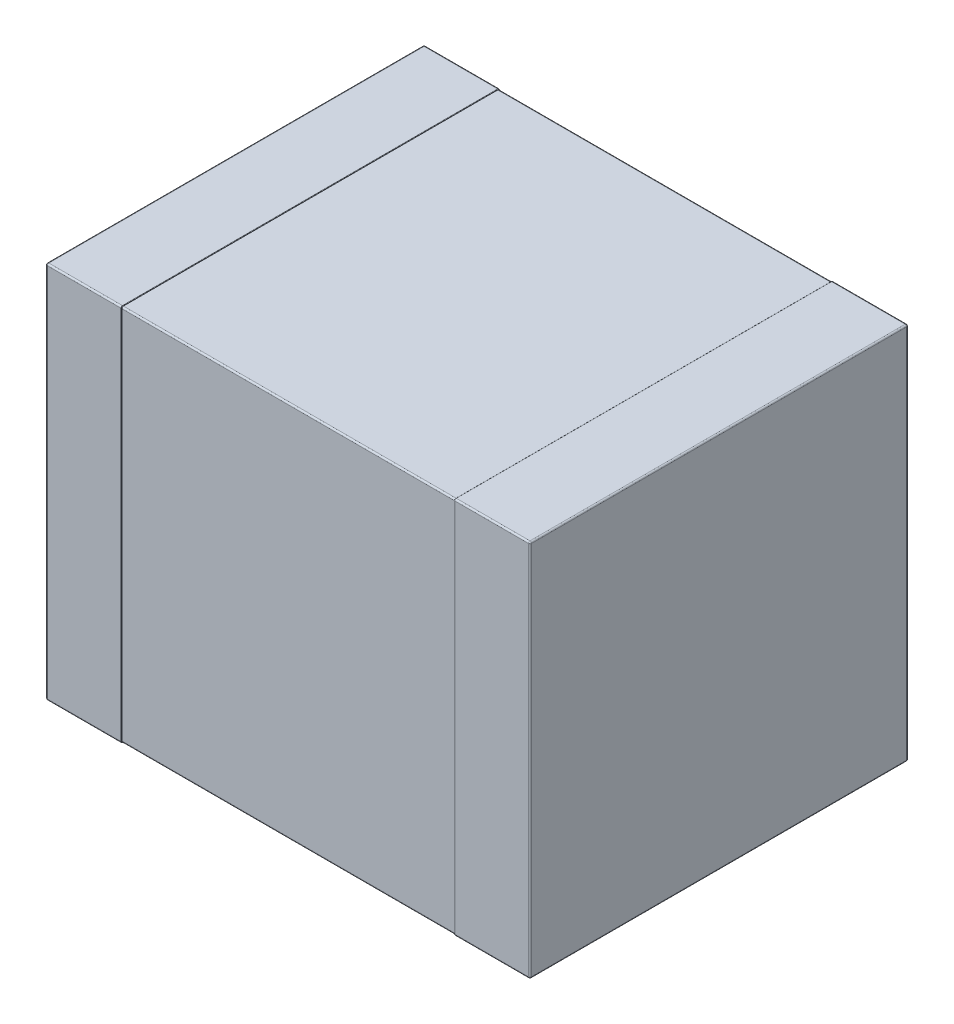
from build123d import *

# Parameters (mm, degrees)
SKETCH1_W                           = 3.2
SKETCH1_H                           = 2.5
ALL_BODY_DEPTH                      = 2.5
CUT_OUT_THE_BODY_FOR_PIN_DEPTH      = 1.1
CUT_OUT_THE_BODY_FOR_PIN_DEPTH_BACK = 1.1
SKETCH2_OUTSIDE_W                   = 5.454
SKETCH2_OUTSIDE_H                   = 5.454
SKETCH2_OUTSIDE_W_2                 = 2.494
SKETCH2_OUTSIDE_H_2                 = 2.494
BODY_FILLET_R                       = 0.01
PIN_FILLET_A_R                      = 0.01
PIN_FILLET_B_R                      = 0.003


with BuildPart() as part:
    # Sketch1 → All body (new body)
    with BuildSketch(Plane.XY):
        Rectangle(SKETCH1_W, SKETCH1_H)
    extrude(amount=ALL_BODY_DEPTH)

    # Sketch2 outside → Cut out the body for pin (cut, two sides: drawn at the far end of the back side and taken through both)
    with BuildSketch(Plane(origin=(0, 0, 0), x_dir=(0, 0, -1), z_dir=(1, 0, 0)).offset(-CUT_OUT_THE_BODY_FOR_PIN_DEPTH_BACK)):
        with Locations((-1.25, 0)):
            Rectangle(SKETCH2_OUTSIDE_W, SKETCH2_OUTSIDE_H)
        with Locations((-1.25, 0)):
            Rectangle(SKETCH2_OUTSIDE_W_2, SKETCH2_OUTSIDE_H_2, mode=Mode.SUBTRACT)
    extrude(amount=CUT_OUT_THE_BODY_FOR_PIN_DEPTH + CUT_OUT_THE_BODY_FOR_PIN_DEPTH_BACK, mode=Mode.SUBTRACT)

    # Body fillet
    body_fillet_edges = [part.edges().sort_by_distance(p)[0] for p in [
        (0, 1.247, 0.003),
        (0, 1.247, 2.497),
        (0, -1.247, 2.497),
        (0, -1.247, 0.003),
    ]]
    fillet(body_fillet_edges, radius=BODY_FILLET_R)

    # Pin fillet a
    pin_fillet_a_edges = [part.edges().sort_by_distance(p)[0] for p in [
        (1.6, 0, 2.5),
        (-1.35, 1.25, 0),
        (1.35, -1.25, 0),
        (1.35, -1.25, 2.5),
        (-1.35, 1.25, 2.5),
        (1.35, 1.25, 2.5),
        (-1.6, 0, 2.5),
        (1.35, 1.25, 0),
        (1.6, 0, 0),
        (-1.35, -1.25, 0),
        (-1.6, 0, 0),
        (-1.6, 1.25, 1.25),
        (1.6, 1.25, 1.25),
        (1.6, -1.25, 1.25),
        (-1.6, -1.25, 1.25),
        (-1.35, -1.25, 2.5),
    ]]
    fillet(pin_fillet_a_edges, radius=PIN_FILLET_A_R)

    # Pin fillet b
    pin_fillet_b_edges = [part.edges().sort_by_distance(p)[0] for p in [
        (1.1, -1.25, 1.25),
        (1.1, 0, 2.5),
        (1.1, 1.25, 1.25),
        (1.1, 0, 0),
        (-1.1, 1.25, 1.25),
        (-1.1, 0, 2.5),
        (-1.1, -1.25, 1.25),
        (-1.1, 0, 0),
        (1.1, 1.247071068, 0.002928932),
        (1.1, -1.247071068, 0.002928932),
        (1.1, -1.247071068, 2.497071068),
        (1.1, 1.247071068, 2.497071068),
        (-1.1, -1.247071068, 2.497071068),
        (-1.1, 1.247071068, 2.497071068),
        (-1.1, -1.247071068, 0.002928932),
        (-1.1, 1.247071068, 0.002928932),
    ]]
    fillet(pin_fillet_b_edges, radius=PIN_FILLET_B_R - 0.0001)  # a hair under: the kernel refuses the full size


solid = part.part
